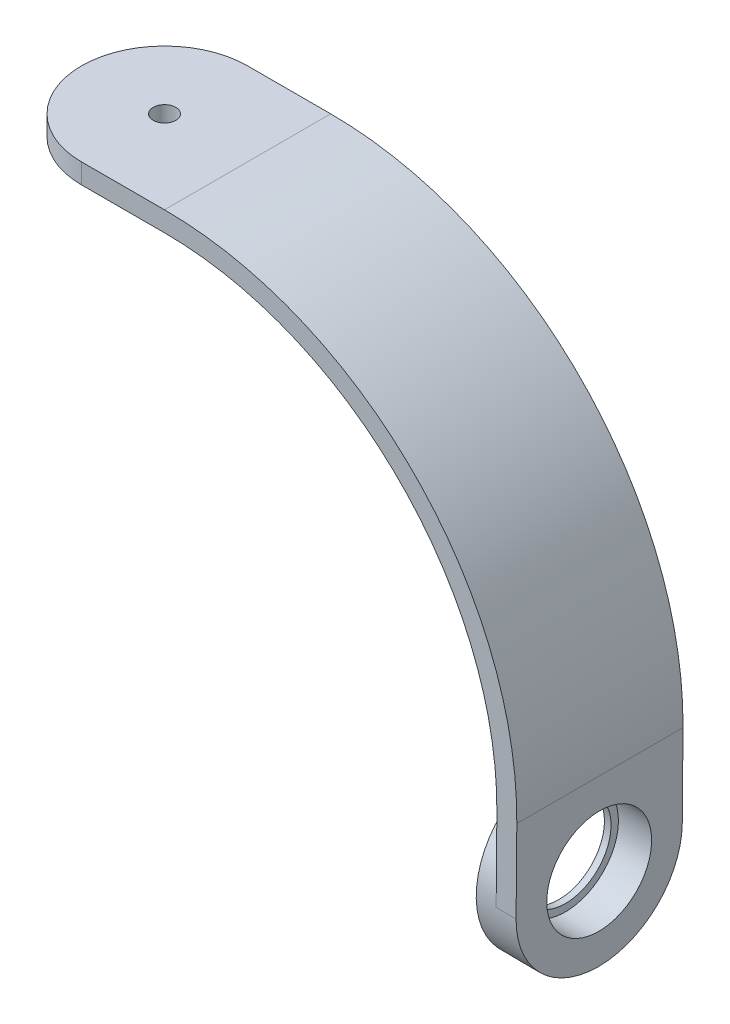
from build123d import *

# Parameters (mm, degrees)
BOSS_EXTRUDE1_DEPTH = 25
CUT_EXTRUDE1_REACH  = 99.811
SKETCH6_R           = 7.89
FILLET1_R           = 12.5
FILLET2_R           = 12.5
SKETCH7_R           = 12.5
SKETCH7_R_2         = 6.79
BOSS_EXTRUDE2_DEPTH = 3
SKETCH8_R           = 7.89
CUT_EXTRUDE2_DEPTH  = 5
CUT_EXTRUDE3_REACH  = 99.93
SKETCH9_R           = 1.7


with BuildPart() as part:
    # Sketch2 → Boss-Extrude1 (new body)
    with BuildSketch(Plane.XY):
        with BuildLine():
            Line((0, 53), (-25, 53))
            Line((-25, 53), (-25, 50))
            Line((-25, 50), (0, 50))
            ThreePointArc((0, 50), (35.509268781, 35.200736223), (49.998096153, -0.436326775))
            Line((49.998096153, -0.436326775), (49.779932766, -25.435374852))
            Line((49.779932766, -25.435374852), (52.779818535, -25.461554458))
            Line((52.779818535, -25.461554458), (52.997981922, -0.462506381))
            ThreePointArc((52.997981922, -0.462506381), (37.639824908, 37.312780396), (0, 53))
        make_face()
    extrude(amount=BOSS_EXTRUDE1_DEPTH)

    # Sketch6 → Cut-Extrude1 (cut, up to next)
    with BuildSketch(Plane(origin=(52.997981922, -0.462506381, 0), x_dir=(0, 0, -1), z_dir=(0.9999619230641714, -0.00872653549837746, 0)), mode=Mode.PRIVATE) as cut_extrude1_sk1:
        with Locations(Location((-12.5, -12.5, 0), (0, 0, 90))):
            Circle(SKETCH6_R)
    cut_extrude1_tool1 = extrude(cut_extrude1_sk1.sketch, amount=-CUT_EXTRUDE1_REACH, mode=Mode.PRIVATE) & part.part
    add(cut_extrude1_tool1.solids().sort_by_distance((52.8889, -12.96203, 12.5))[0], mode=Mode.SUBTRACT)

    # Fillet1
    fillet1_edges = [part.edges().sort_by_distance(p)[0] for p in [
        (51.27987565, -25.448464655, 0),
        (51.27987565, -25.448464655, 25),
    ]]
    fillet(fillet1_edges, radius=FILLET1_R - 0.0001)  # a hair under: the kernel refuses the full size

    # Fillet2
    fillet2_edges = [part.edges().sort_by_distance(p)[0] for p in [
        (-25, 51.5, 25),
        (-25, 51.5, 0),
    ]]
    fillet(fillet2_edges, radius=FILLET2_R - 0.0001)  # a hair under: the kernel refuses the full size

    # Sketch7 → Boss-Extrude2 (add)
    with BuildSketch(Plane(origin=(49.998096153, -0.436326775, 0), x_dir=(0, 0, 1), z_dir=(-0.9999619230641714, 0.008726535498377049, 0))):
        with Locations(Location((12.5, -12.5, 0), (0, 0, 270))):
            Circle(SKETCH7_R)
        with Locations(Location((12.5, -12.5, 0), (0, 0, 270))):
            Circle(SKETCH7_R_2, mode=Mode.SUBTRACT)
    extrude(amount=BOSS_EXTRUDE2_DEPTH)

    # Sketch8 → Cut-Extrude2 (cut)
    with BuildSketch(Plane(origin=(52.997981922, -0.462506381, 0), x_dir=(0, 0, -1), z_dir=(0.9999619230641714, -0.00872653549837732, 0))):
        with Locations(Location((-12.5, -12.5, 0), (0, 0, 90))):
            Circle(SKETCH8_R)
    extrude(amount=-CUT_EXTRUDE2_DEPTH, mode=Mode.SUBTRACT)

    # Sketch9 → Cut-Extrude3 (cut, up to next)
    with BuildSketch(Plane(origin=(0, 53, 0), x_dir=(1, 0, 0), z_dir=(0, 1, 0)), mode=Mode.PRIVATE) as cut_extrude3_sk1:
        with Locations(Location((-12.5, -12.5, 0), (0, 0, 270))):
            Circle(SKETCH9_R)
    cut_extrude3_tool1 = extrude(cut_extrude3_sk1.sketch, amount=-CUT_EXTRUDE3_REACH, mode=Mode.PRIVATE) & part.part
    add(cut_extrude3_tool1.solids().sort_by_distance((-12.5, 53, 12.5))[0], mode=Mode.SUBTRACT)


solid = part.part
